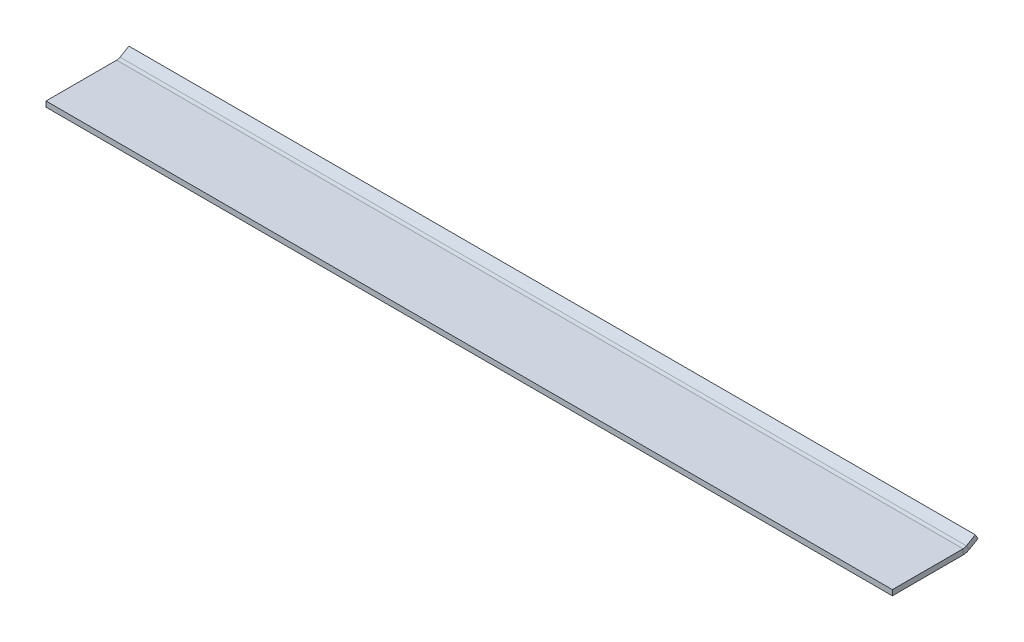
from build123d import *

# Parameters (mm, degrees)
SKETCH1_W            = 1880
SKETCH1_H            = 185
BASE_FLANGE1_DEPTH   = 12
EDGE_FLANGE1_START   = -940
EDGE_FLANGE1_DEPTH   = 1880
EDGE_FLANGE1_2_DEPTH = 1880


# Read off the part's stored shape, not the designer's step: Edge-Flange1
# Sheet-metal steps are written as plain solids
with BuildPart() as part:
    # Sketch1 → Base-Flange1 (new body)
    with BuildSketch(Plane(origin=(0, 0, 0), x_dir=(1, 0, 0), z_dir=(0, 1, 0))):
        Rectangle(SKETCH1_W, SKETCH1_H)
    extrude(amount=-BASE_FLANGE1_DEPTH)

    # Edge-Flange1 outline → Edge-Flange1 (cut)
    with BuildSketch(Plane.YZ.offset(EDGE_FLANGE1_START)):
        with BuildLine():
            Line((0, -92.5), (-8.382685902, -77.980762114))
            ThreePointArc((-8.382685902, -77.980762114), (-11.07999731, -71.468876332), (-12, -64.480762114))
            Line((-12, -64.480762114), (-12, -92.5))
            Line((-12, -92.5), (0, -92.5))
        make_face()
    extrude(amount=EDGE_FLANGE1_DEPTH, mode=Mode.SUBTRACT)

    # Edge-Flange1 2 outline → Edge-Flange1 2 (add)
    with BuildSketch(Plane.YZ.offset(EDGE_FLANGE1_START)):
        with BuildLine():
            Line((0, -64.480762114), (0, -92.5))
            Line((0, -92.5), (3, -97.696152423))
            Line((3, -97.696152423), (13.392304845, -91.696152423))
            Line((13.392304845, -91.696152423), (2.009618943, -71.980762114))
            ThreePointArc((2.009618943, -71.980762114), (0.511112606, -68.36304779), (0, -64.480762114))
        make_face()
    extrude(amount=EDGE_FLANGE1_2_DEPTH)


solid = part.part
